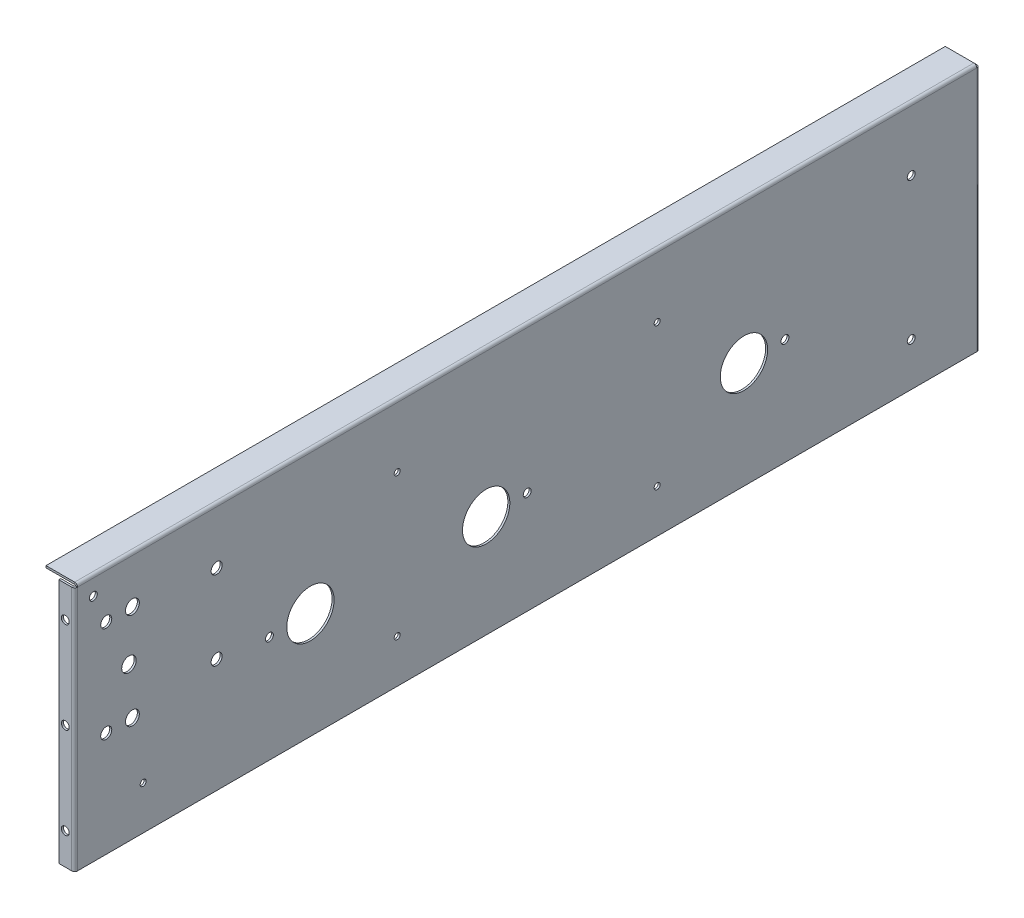
from build123d import *

# Parameters (mm, degrees)
SKETCH1_W                    = 723.9
SKETCH1_H                    = 200.152
SKETCH1_R                    = 3.175
SKETCH1_R_2                  = 2.413
BASE_FLANGE1_DEPTH           = 1.6002
EDGE_FLANGE1_STRIP_W         = 7.874
EDGE_FLANGE1_STRIP_H         = 1.6002
EDGE_FLANGE1_STRIP_CUT_DEPTH = 723.9
EDGE_FLANGE1_DEPTH           = 723.9
SKETCH11_R                   = 19.05
CUT_EXTRUDE1_DEPTH           = 377.283721088
CUT_EXTRUDE3_REACH           = 378.388
SKETCH23_R                   = 5.55625
SKETCH23_R_2                 = 5.842
CUT_EXTRUDE4_REACH           = 378.388
SKETCH24_R                   = 4.445
EDGE_FLANGE2_DEPTH           = 197.8152
EDGE_FLANGE2_BEND_DEPTH      = 197.8152
SKETCH34_R                   = 3.175
CUT_EXTRUDE5_DEPTH           = 736.85314866
SKETCH35_R                   = 3.175
CUT_EXTRUDE6_DEPTH           = 379.53204476
CUT_EXTRUDE7_REACH           = 380.636
SKETCH36_R                   = 4.445


# Sheet-metal steps are written as plain solids
with BuildPart() as part:
    # Sketch1 → Base-Flange1 (new body)
    with BuildSketch(Plane(origin=(0, 0, 0), x_dir=(0, 0, -1), z_dir=(1, 0, 0))):
        Rectangle(SKETCH1_W, SKETCH1_H)
        with Locations((-207.518, -14.351)):
            Circle(SKETCH1_R, mode=Mode.SUBTRACT)
        with Locations((0, -17.526)):
            Circle(SKETCH1_R, mode=Mode.SUBTRACT)
        with Locations((207.518, -14.351)):
            Circle(SKETCH1_R, mode=Mode.SUBTRACT)
        with Locations((-104.638118017, 49.149)):
            Circle(SKETCH1_R_2, mode=Mode.SUBTRACT)
        with Locations((-104.638118017, -65.151)):
            Circle(SKETCH1_R_2, mode=Mode.SUBTRACT)
        with Locations((104.638118017, -65.151)):
            Circle(SKETCH1_R_2, mode=Mode.SUBTRACT)
        with Locations((104.638118017, 49.149)):
            Circle(SKETCH1_R_2, mode=Mode.SUBTRACT)
        with Locations((309.118, 49.149)):
            Circle(SKETCH1_R, mode=Mode.SUBTRACT)
        with Locations((309.118, -65.151)):
            Circle(SKETCH1_R, mode=Mode.SUBTRACT)
        with Locations((-309.118, -65.151)):
            Circle(SKETCH1_R_2, mode=Mode.SUBTRACT)
    extrude(amount=-BASE_FLANGE1_DEPTH)

    # Edge-Flange1 strip (across the edge) → Edge-Flange1 strip cut (cut)
    with BuildSketch(Plane(origin=(-1.6002, 100.076, 361.95), x_dir=(0, -1, 0), z_dir=(0, 0, -1))):
        with Locations((-1.6002, -0.8001)):
            Rectangle(EDGE_FLANGE1_STRIP_W, EDGE_FLANGE1_STRIP_H)
    extrude(amount=EDGE_FLANGE1_STRIP_CUT_DEPTH, mode=Mode.SUBTRACT)

    # Edge-Flange1 section (across the edge) → Edge-Flange1 (add)
    with BuildSketch(Plane(origin=(-1.6002, 100.076, 361.95), x_dir=(0, -1, 0), z_dir=(0, 0, -1))):
        with BuildLine():
            Line((0, 0.7366), (0, 23.7998))
            Line((0, 23.7998), (1.6002, 23.7998))
            Line((1.6002, 23.7998), (1.6002, 0.7366))
            ThreePointArc((1.6002, 0.7366), (1.815945145, 0.215745145), (2.3368, 0))
            Line((2.3368, 0), (2.3368, -1.6002))
            ThreePointArc((2.3368, -1.6002), (0.684432874, -0.915767126), (0, 0.7366))
        make_face()
    extrude(amount=EDGE_FLANGE1_DEPTH)

    # Sketch11 → Cut-Extrude1 (cut, through all)
    with BuildSketch(Plane.ZY.offset(1.6002)):
        with Locations((-174.498, -14.351)):
            Circle(SKETCH11_R)
        with Locations((33.02, -17.526)):
            Circle(SKETCH11_R)
        with Locations((174.498, -14.351)):
            Circle(SKETCH11_R)
    extrude(amount=-CUT_EXTRUDE1_DEPTH, mode=Mode.SUBTRACT)

    # Sketch23 → Cut-Extrude3 (cut, up to next)
    with BuildSketch(Plane(origin=(0, 0, 0), x_dir=(0, 0, -1), z_dir=(1, 0, 0)), mode=Mode.PRIVATE) as cut_extrude3_sk1:
        with Locations((-317.778063087, 62.003449438)):
            Circle(SKETCH23_R)
    cut_extrude3_tool1 = extrude(cut_extrude3_sk1.sketch, amount=-CUT_EXTRUDE3_REACH, mode=Mode.PRIVATE) & part.part
    # Sketch23 → Cut-Extrude3 (cut, up to next)
    with BuildSketch(Plane(origin=(0, 0, 0), x_dir=(0, 0, -1), z_dir=(1, 0, 0)), mode=Mode.PRIVATE) as cut_extrude3_sk2:
        with Locations((-320.548, 23.268449438)):
            Circle(SKETCH23_R_2)
    cut_extrude3_tool2 = extrude(cut_extrude3_sk2.sketch, amount=-CUT_EXTRUDE3_REACH, mode=Mode.PRIVATE) & part.part
    # Sketch23 → Cut-Extrude3 (cut, up to next)
    with BuildSketch(Plane(origin=(0, 0, 0), x_dir=(0, 0, -1), z_dir=(1, 0, 0)), mode=Mode.PRIVATE) as cut_extrude3_sk3:
        with Locations((-317.778063087, -15.466550562)):
            Circle(SKETCH23_R)
    cut_extrude3_tool3 = extrude(cut_extrude3_sk3.sketch, amount=-CUT_EXTRUDE3_REACH, mode=Mode.PRIVATE) & part.part
    add(cut_extrude3_tool1.solids().sort_by_distance((0, 62.003449, 317.778063))[0], mode=Mode.SUBTRACT)
    add(cut_extrude3_tool2.solids().sort_by_distance((0, 23.268449, 320.548))[0], mode=Mode.SUBTRACT)
    add(cut_extrude3_tool3.solids().sort_by_distance((0, -15.466551, 317.778063))[0], mode=Mode.SUBTRACT)

    # Sketch24 → Cut-Extrude4 (cut, up to next)
    with BuildSketch(Plane(origin=(0, 0, 0), x_dir=(0, 0, -1), z_dir=(1, 0, 0)), mode=Mode.PRIVATE) as cut_extrude4_sk1:
        with Locations((-338.860063087, 62.003449438)):
            Circle(SKETCH24_R)
    cut_extrude4_tool1 = extrude(cut_extrude4_sk1.sketch, amount=-CUT_EXTRUDE4_REACH, mode=Mode.PRIVATE) & part.part
    # Sketch24 → Cut-Extrude4 (cut, up to next)
    with BuildSketch(Plane(origin=(0, 0, 0), x_dir=(0, 0, -1), z_dir=(1, 0, 0)), mode=Mode.PRIVATE) as cut_extrude4_sk2:
        with Locations((-338.860063087, -15.466550562)):
            Circle(SKETCH24_R)
    cut_extrude4_tool2 = extrude(cut_extrude4_sk2.sketch, amount=-CUT_EXTRUDE4_REACH, mode=Mode.PRIVATE) & part.part
    add(cut_extrude4_tool1.solids().sort_by_distance((0, 62.003449, 338.860063))[0], mode=Mode.SUBTRACT)
    add(cut_extrude4_tool2.solids().sort_by_distance((0, -15.466551, 338.860063))[0], mode=Mode.SUBTRACT)

    # Edge-Flange2 section (across the edge) → Edge-Flange2 (add)
    with BuildSketch(Plane(origin=(-1.6002, 97.7392, -362.6866), x_dir=(0, 0, 1), z_dir=(0, -1, 0))):
        with BuildLine():
            Line((-1.6002, 0.7366), (-1.6002, 11.0998))
            Line((-1.6002, 11.0998), (0, 11.0998))
            Line((0, 11.0998), (0, 0.7366))
            ThreePointArc((0, 0.7366), (0.215745145, 0.215745145), (0.7366, 0))
            Line((0.7366, 0), (0.7366, -1.6002))
            ThreePointArc((0.7366, -1.6002), (-0.915767126, -0.915767126), (-1.6002, 0.7366))
        make_face()
    extrude(amount=EDGE_FLANGE2_DEPTH)

    # Edge-Flange2 section 2 (across the edge) → Edge-Flange2 bend (add)
    with BuildSketch(Plane(origin=(-1.6002, -100.076, 362.6866), x_dir=(0, 0, -1), z_dir=(0, 1, 0))):
        with BuildLine():
            Line((-1.6002, 0.7366), (-1.6002, 11.0998))
            Line((-1.6002, 11.0998), (0, 11.0998))
            Line((0, 11.0998), (0, 0.7366))
            ThreePointArc((0, 0.7366), (0.215745145, 0.215745145), (0.7366, 0))
            Line((0.7366, 0), (0.7366, -1.6002))
            ThreePointArc((0.7366, -1.6002), (-0.915767126, -0.915767126), (-1.6002, 0.7366))
        make_face()
    extrude(amount=EDGE_FLANGE2_BEND_DEPTH)

    # Sketch34 → Cut-Extrude5 (cut, through all)
    with BuildSketch(Plane.XY.offset(364.2868)):
        with Locations((-7.5184, 72.3392)):
            Circle(SKETCH34_R)
        with Locations((-7.5184, -1.1684)):
            Circle(SKETCH34_R)
        with Locations((-7.5184, -74.676)):
            Circle(SKETCH34_R)
    extrude(amount=-CUT_EXTRUDE5_DEPTH, mode=Mode.SUBTRACT)

    # Sketch35 → Cut-Extrude6 (cut, through all)
    with BuildSketch(Plane.ZY.offset(1.6002)):
        with Locations((349.25, 85.0392)):
            Circle(SKETCH35_R)
    extrude(amount=-CUT_EXTRUDE6_DEPTH, mode=Mode.SUBTRACT)

    # Sketch36 → Cut-Extrude7 (cut, up to next)
    with BuildSketch(Plane(origin=(0, 0, 0), x_dir=(0, 0, -1), z_dir=(1, 0, 0)), mode=Mode.PRIVATE) as cut_extrude7_sk1:
        with Locations((-249.960063087, 55.018449438)):
            Circle(SKETCH36_R)
    cut_extrude7_tool1 = extrude(cut_extrude7_sk1.sketch, amount=-CUT_EXTRUDE7_REACH, mode=Mode.PRIVATE) & part.part
    # Sketch36 → Cut-Extrude7 (cut, up to next)
    with BuildSketch(Plane(origin=(0, 0, 0), x_dir=(0, 0, -1), z_dir=(1, 0, 0)), mode=Mode.PRIVATE) as cut_extrude7_sk2:
        with Locations((-249.960063087, -8.481550562)):
            Circle(SKETCH36_R)
    cut_extrude7_tool2 = extrude(cut_extrude7_sk2.sketch, amount=-CUT_EXTRUDE7_REACH, mode=Mode.PRIVATE) & part.part
    add(cut_extrude7_tool1.solids().sort_by_distance((0, 55.018449, 249.960063))[0], mode=Mode.SUBTRACT)
    add(cut_extrude7_tool2.solids().sort_by_distance((0, -8.481551, 249.960063))[0], mode=Mode.SUBTRACT)


solid = part.part
